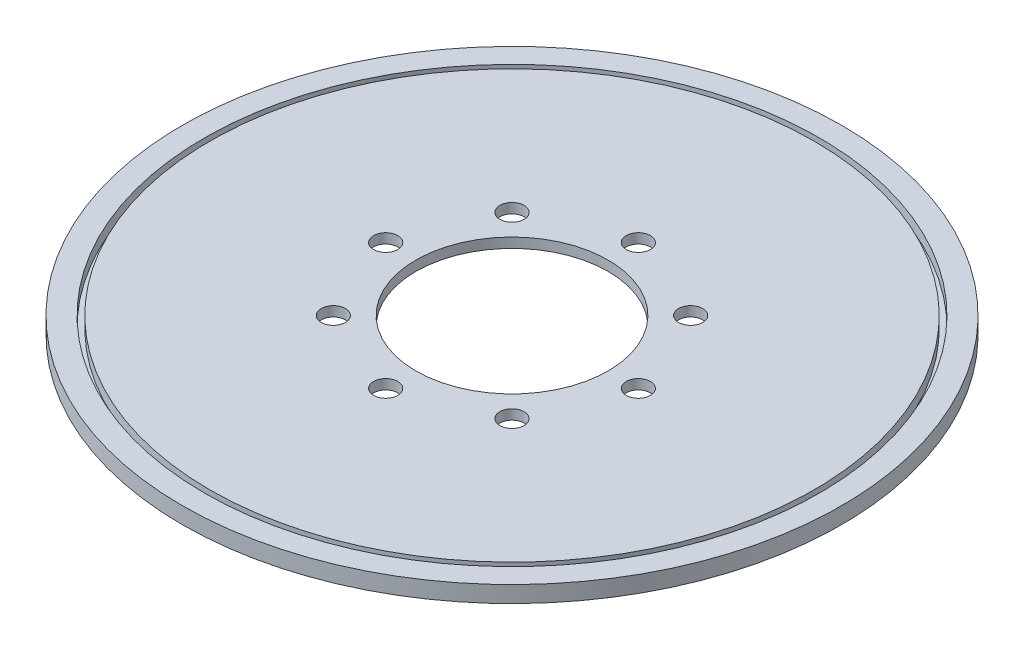
from build123d import *

# Parameters (mm, degrees)
SKETCH1_R          = 300
PLATE_DEPTH        = 15
SKETCH2_R          = 87.5
BEARING_HOLE_DEPTH = 425.529150943
SKETCH4_R          = 280
SKETCH4_R_2        = 275
CUT_EXTRUDE3_DEPTH = 10
SKETCH5_R          = 135
CUT_EXTRUDE4_DEPTH = 6
SKETCH6_R          = 6
CUT_EXTRUDE5_DEPTH = 425.359517391
SKETCH7_R          = 11
CUT_EXTRUDE6_DEPTH = 14


with BuildPart() as part:
    # Sketch1 → plate (new body)
    with BuildSketch(Plane(origin=(0, 0, 0), x_dir=(1, 0, 0), z_dir=(0, 1, 0))):
        Circle(SKETCH1_R)
    extrude(amount=PLATE_DEPTH)

    # Sketch2 → bearing-hole (cut, through all)
    with BuildSketch(Plane(origin=(0, 15, 0), x_dir=(1, 0, 0), z_dir=(0, 1, 0))):
        Circle(SKETCH2_R)
    extrude(amount=-BEARING_HOLE_DEPTH, mode=Mode.SUBTRACT)

    # Sketch4 → Cut-Extrude3 (cut)
    with BuildSketch(Plane(origin=(0, 15, 0), x_dir=(1, 0, 0), z_dir=(0, 1, 0))):
        Circle(SKETCH4_R)
        Circle(SKETCH4_R_2, mode=Mode.SUBTRACT)
    extrude(amount=-CUT_EXTRUDE3_DEPTH, mode=Mode.SUBTRACT)

    # Sketch5 → Cut-Extrude4 (cut)
    with BuildSketch(Plane.XZ):
        Circle(SKETCH5_R)
    extrude(amount=-CUT_EXTRUDE4_DEPTH, mode=Mode.SUBTRACT)

    # Sketch6 → Cut-Extrude5 (cut, through all)
    with BuildSketch(Plane.XZ.offset(-6)):
        with Locations((0, 115)):
            Circle(SKETCH6_R)
        with Locations((81.317279836, 81.317279836)):
            Circle(SKETCH6_R)
        with Locations((115, 0)):
            Circle(SKETCH6_R)
        with Locations((81.317279836, -81.317279836)):
            Circle(SKETCH6_R)
        with Locations((0, -115)):
            Circle(SKETCH6_R)
        with Locations((-81.317279836, -81.317279836)):
            Circle(SKETCH6_R)
        with Locations((-115, 0)):
            Circle(SKETCH6_R)
        with Locations((-81.317279836, 81.317279836)):
            Circle(SKETCH6_R)
    extrude(amount=-CUT_EXTRUDE5_DEPTH, mode=Mode.SUBTRACT)

    # Sketch7 → Cut-Extrude6 (cut)
    with BuildSketch(Plane(origin=(0, 15, 0), x_dir=(1, 0, 0), z_dir=(0, 1, 0))):
        with Locations((0, 115)):
            Circle(SKETCH7_R)
        with Locations((81.317279836, 81.317279836)):
            Circle(SKETCH7_R)
        with Locations((115, 0)):
            Circle(SKETCH7_R)
        with Locations((81.317279836, -81.317279836)):
            Circle(SKETCH7_R)
        with Locations((0, -115)):
            Circle(SKETCH7_R)
        with Locations((-81.317279836, -81.317279836)):
            Circle(SKETCH7_R)
        with Locations((-115, 0)):
            Circle(SKETCH7_R)
        with Locations((-81.317279836, 81.317279836)):
            Circle(SKETCH7_R)
    extrude(amount=-CUT_EXTRUDE6_DEPTH, mode=Mode.SUBTRACT)


solid = part.part
